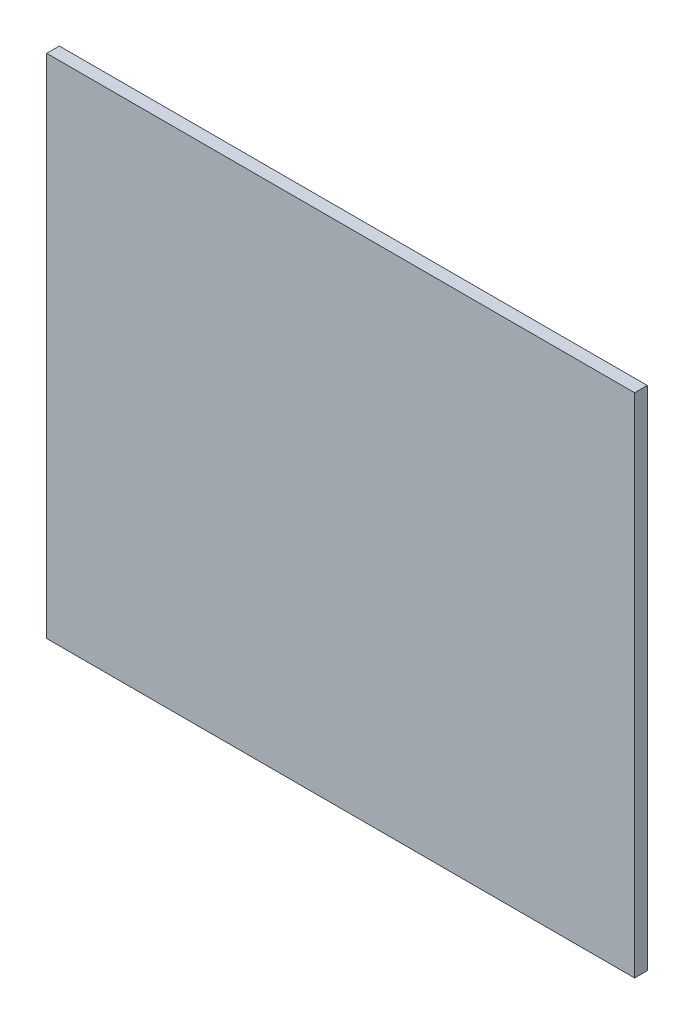
from build123d import *

# Parameters (mm, degrees)
SKETCH2_W           = 552.45
SKETCH2_H           = 476.25
BOSS_EXTRUDE1_DEPTH = 11.90625


with BuildPart() as part:
    # Sketch2 → Boss-Extrude1 (new body)
    with BuildSketch(Plane.XY):
        with Locations((58.426633168, 19.760755995)):
            Rectangle(SKETCH2_W, SKETCH2_H)
    extrude(amount=BOSS_EXTRUDE1_DEPTH)


solid = part.part
